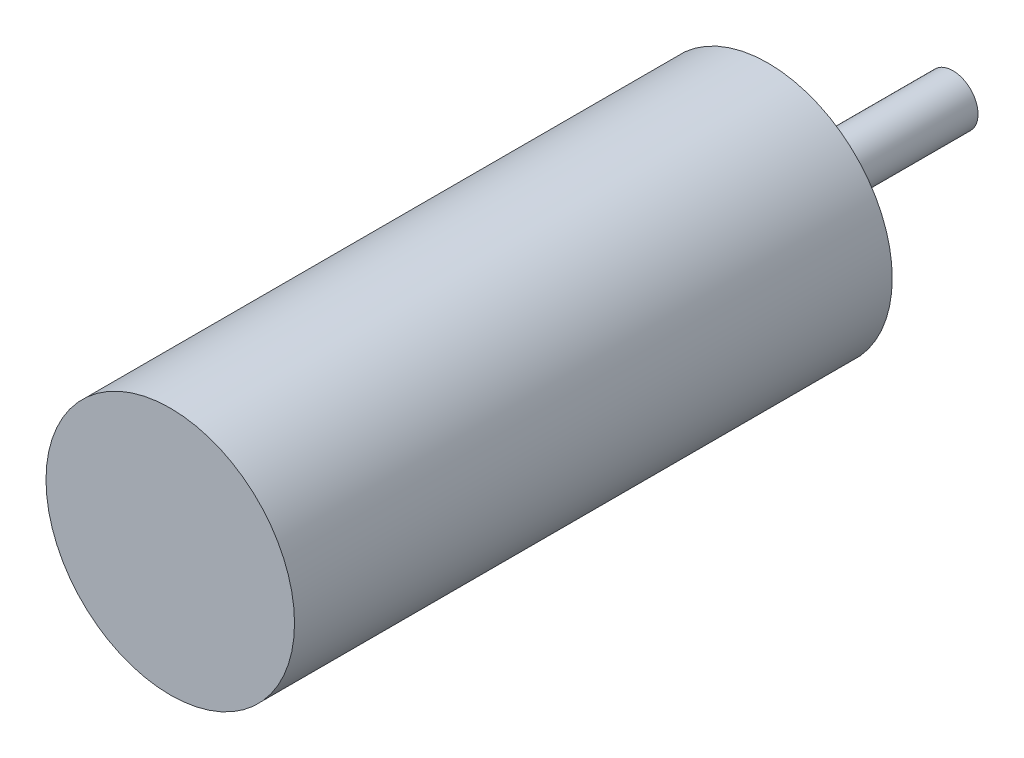
from build123d import *

# Parameters (mm, degrees)
SKETCH2_R           = 19.75
BOSS_EXTRUDE1_DEPTH = 95
SKETCH3_R           = 4
BOSS_EXTRUDE2_DEPTH = 29.3878


with BuildPart() as part:
    # Sketch2 → Boss-Extrude1 (new body)
    with BuildSketch(Plane.XY):
        Circle(SKETCH2_R)
    extrude(amount=-BOSS_EXTRUDE1_DEPTH)

    # Sketch3 → Boss-Extrude2 (add)
    with BuildSketch(Plane(origin=(0, 0, -95), x_dir=(-1, 0, 0), z_dir=(0, 0, -1))):
        Circle(SKETCH3_R)
    extrude(amount=BOSS_EXTRUDE2_DEPTH)


solid = part.part
